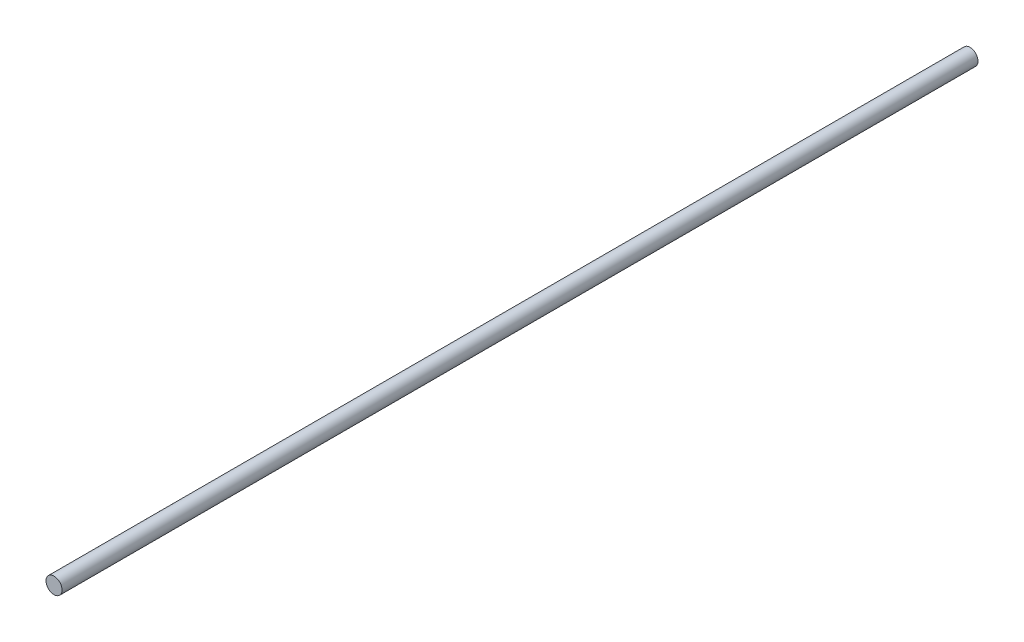
from build123d import *

# Parameters (mm, degrees)
ESQUISSE1_R        = 2.5
BOSS_EXTRU_1_DEPTH = 285


with BuildPart() as part:
    # Esquisse1 → Boss.-Extru.1 (new body)
    with BuildSketch(Plane.XY):
        Circle(ESQUISSE1_R)
    extrude(amount=BOSS_EXTRU_1_DEPTH)


solid = part.part
